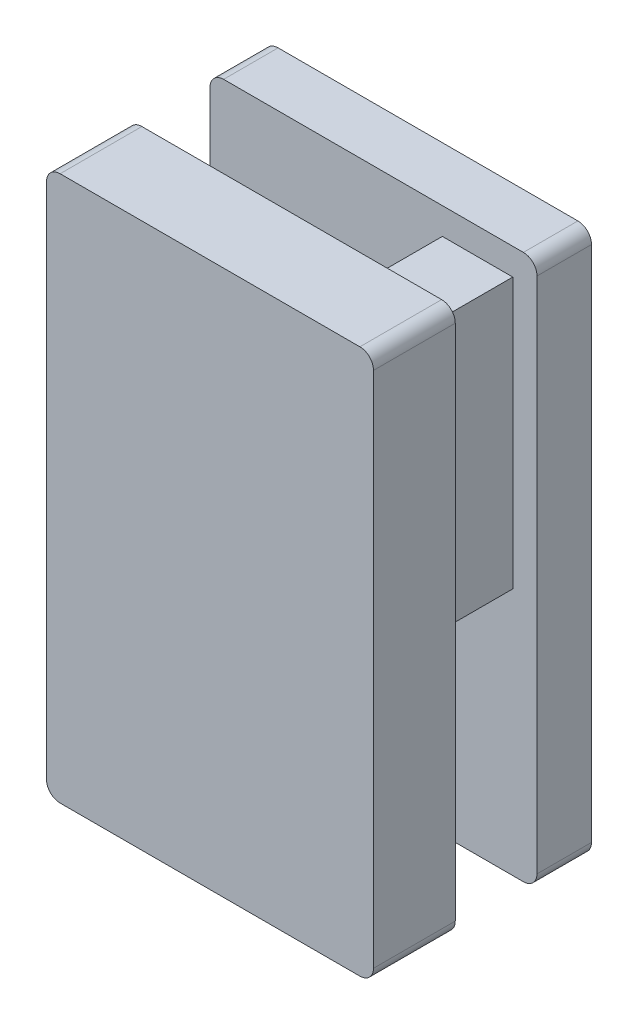
from build123d import *

# Parameters (mm, degrees)
SKETCH1_W           = 12
SKETCH1_H           = 20
BOSS_EXTRUDE1_DEPTH = 2
SKETCH2_W           = 2.583613584
SKETCH2_H           = 9.909750732
BOSS_EXTRUDE2_DEPTH = 3
SKETCH3_W           = 12
SKETCH3_H           = 20
BOSS_EXTRUDE3_DEPTH = 3
FILLET1_R           = 0.5


with BuildPart() as part:
    # Sketch1 → Boss-Extrude1 (new body)
    with BuildSketch(Plane.XY):
        with Locations((68.585871194, -163)):
            Rectangle(SKETCH1_W, SKETCH1_H)
    extrude(amount=BOSS_EXTRUDE1_DEPTH)

    # Sketch2 → Boss-Extrude2 (add)
    with BuildSketch(Plane.XY.offset(2)):
        with Locations((72.404631484, -158.933321579)):
            Rectangle(SKETCH2_W, SKETCH2_H)
    extrude(amount=BOSS_EXTRUDE2_DEPTH)

    # Sketch3 → Boss-Extrude3 (add)
    with BuildSketch(Plane.XY.offset(5)):
        with Locations((68.585871194, -163)):
            Rectangle(SKETCH3_W, SKETCH3_H)
    extrude(amount=BOSS_EXTRUDE3_DEPTH)

    # Fillet1
    fillet1_edges = [part.edges().sort_by_distance(p)[0] for p in [
        (74.585871194, -153, 6.5),
        (74.585871194, -153, 1),
        (62.585871194, -153, 6.5),
        (62.585871194, -153, 1),
        (62.585871194, -173, 6.5),
        (74.585871194, -173, 6.5),
        (74.585871194, -173, 1),
        (62.585871194, -173, 1),
    ]]
    fillet(fillet1_edges, radius=FILLET1_R)


solid = part.part
